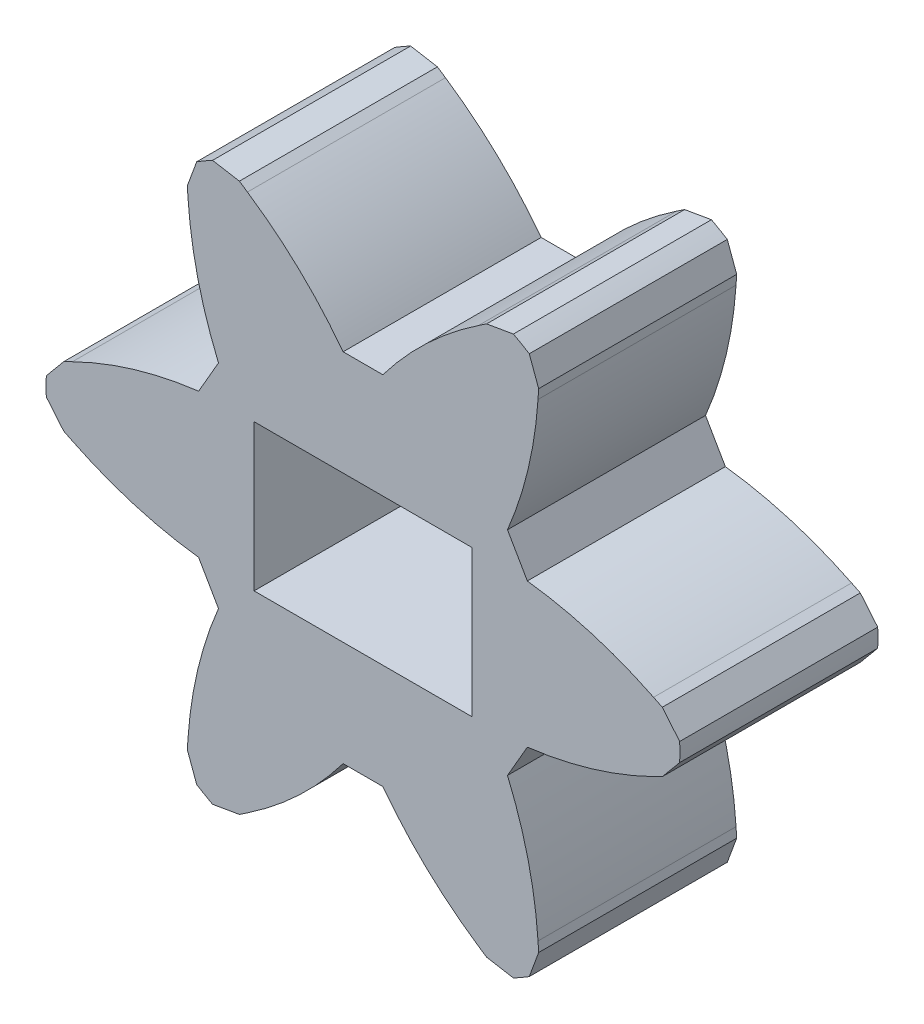
from build123d import *
from OCP.BRepFilletAPI import BRepFilletAPI_MakeChamfer

# Parameters (mm, degrees)
SKETCH1_R           = 8
SKETCH1_W           = 5.5
SKETCH1_H           = 3.7
BOSS_EXTRUDE1_DEPTH = 5
CUT_EXTRUDE1_DEPTH  = 13.369316877
CIRPATTERN1_COUNT   = 6
FILLET1_R           = 10
CHAMFER1_SIZE       = 1
CHAMFER1_SIZE2      = 0.5


with BuildPart() as part:
    # Sketch1 → Boss-Extrude1 (new body)
    with BuildSketch(Plane.XY):
        Circle(SKETCH1_R)
        Rectangle(SKETCH1_W, SKETCH1_H, mode=Mode.SUBTRACT)
    extrude(amount=BOSS_EXTRUDE1_DEPTH)

    # Sketch2 → Cut-Extrude1 (cut, through all)
    with BuildSketch(Plane.XY):
        Polygon((-7.331932906, 22.221764399), (0, 24.952212466), (7.331932906, 22.221764399), (3.798424573, 7.040736522), (3.120998591, 6.924019842), (1.330058439, 5.723612136), (0.501497444, 4.50257488), (-0.501497444, 4.50257488), (-1.330058439, 5.723612136), (-3.120998591, 6.924019842), (-3.798424573, 7.040736522), align=None)
    cut_extrude1 = extrude(amount=CUT_EXTRUDE1_DEPTH, mode=Mode.SUBTRACT)

    # CirPattern1: Cut-Extrude1 ×6 about axis
    cirpattern1_axis = Axis((0, 0, 0), (0, 0, 1))
    for i in range(1, CIRPATTERN1_COUNT):
        add(cut_extrude1.rotate(cirpattern1_axis, i * 360 / CIRPATTERN1_COUNT), mode=Mode.SUBTRACT)

    # Fillet1
    # the kernel refuses this fillet: 10 mm, written as the material it takes off along each edge
    with BuildSketch(Plane(origin=(-1.330058439, -5.723612136, -4.777865205), x_dir=(0.5615014183372642, 0.8274757743917586, 0), z_dir=(0, 0, 1)), Plane(origin=(5.621822731, 1.709941671, -4.777865205), x_dir=(-0.997365750808096, 0.07253660534518461, 0), z_dir=(0, 0, 1)), Plane(origin=(4.291764291, -4.013670465, -4.777865205), x_dir=(-0.43586433247083195, 0.9000123797369435, 0), z_dir=(0, 0, 1)), Plane(origin=(-5.621822731, -1.709941671, -4.777865205), x_dir=(0.997365750808096, -0.07253660534518423, 0), z_dir=(0, 0, 1)), Plane(origin=(-4.291764291, 4.013670465, -4.777865205), x_dir=(0.43586433247083256, -0.900012379736943, 0), z_dir=(0, 0, 1)), Plane(origin=(1.330058439, 5.723612136, -4.777865205), x_dir=(-0.561501418337264, -0.8274757743917588, 0), z_dir=(0, 0, 1))) as fillet1_piece_1:
        with BuildLine():
            CenterArc((1.975419419, 9.987502063), FILLET1_R, 247.992328485, 19.142820558)
            Line((-1.771887917, 0.716165173), (-1.846834064, 0.530738436))
            Line((-1.846834064, 0.530738436), (-0.074946147, -0.185426738))
            Line((-0.074946147, -0.185426738), (0, -0.2))
            ThreePointArc((0, -0.2), (0.737808461, -0.2), (1.465620873, -0.199750041))
            Line((1.465620873, -0.199750041), (1.475616922, 0))
        make_face()
    extrude(amount=14.55573041, mode=Mode.SUBTRACT)
    with BuildSketch(Plane(origin=(5.621822731, -1.709941671, -4.777865205), x_dir=(0.8975096924716217, 0.44099473003596645, 0), z_dir=(0, 0, 1)), Plane(origin=(1.330058439, -5.723612136, -4.777865205), x_dir=(0.8306674853820185, -0.5567688288052, 0), z_dir=(0, 0, 1)), Plane(origin=(-4.291764291, -4.013670465, -4.777865205), x_dir=(-0.06684220708960342, -0.9977635588411669, 0), z_dir=(0, 0, 1)), Plane(origin=(-5.621822731, 1.709941671, -4.777865205), x_dir=(-0.8975096924716216, -0.44099473003596684, 0), z_dir=(0, 0, 1)), Plane(origin=(4.291764291, 4.013670465, -4.777865205), x_dir=(0.06684220708960296, 0.9977635588411669, 0), z_dir=(0, 0, 1)), Plane(origin=(-1.330058439, 5.723612136, -4.777865205), x_dir=(-0.8306674853820185, 0.5567688288052001, 0), z_dir=(0, 0, 1))) as fillet1_piece_2:
        with BuildLine():
            CenterArc((1.911146082, 10), FILLET1_R, 250.857179442, 19.142820558)
            Line((-1.368094161, 0.552959012), (-1.433678966, 0.364018192))
            ThreePointArc((-1.433678966, 0.364018192), (-0.758993227, 0.091052768), (-0.074946147, -0.185426738))
            Line((-0.074946147, -0.185426738), (0, -0.2))
            Line((0, -0.2), (1.911146082, -0.2))
            Line((1.911146082, -0.2), (1.911146082, 0))
        make_face()
    extrude(amount=14.55573041, mode=Mode.SUBTRACT)

    # Chamfer1: one chamfer whose edges measure the first distance from different faces: ONE call of the kernel's chamfer builder (chamfer() names one face for all edges)
    chamfer1_edges_1 = [part.edges().sort_by_distance(p)[0] for p in [
        (-2.75, 0, 0),
    ]]
    chamfer1_side_1 = [part.faces().sort_by_distance(p)[0] for p in [
        (-2.75, 0, 2.5),
    ]]
    chamfer1_edges_2 = [part.edges().sort_by_distance(p)[0] for p in [
        (0, -1.85, 0),
    ]]
    chamfer1_side_2 = [part.faces().sort_by_distance(p)[0] for p in [
        (0, -1.85, 2.5),
    ]]
    chamfer1_edges_3 = [part.edges().sort_by_distance(p)[0] for p in [
        (2.75, 0, 0),
    ]]
    chamfer1_side_3 = [part.faces().sort_by_distance(p)[0] for p in [
        (2.75, 0, 2.5),
    ]]
    chamfer1_edges_4 = [part.edges().sort_by_distance(p)[0] for p in [
        (0, 1.85, 0),
    ]]
    chamfer1_side_4 = [part.faces().sort_by_distance(p)[0] for p in [
        (0, 1.85, 2.5),
    ]]
    chamfer1 = BRepFilletAPI_MakeChamfer(part.part.solid().wrapped)
    for e in chamfer1_edges_1:
        chamfer1.Add(CHAMFER1_SIZE, CHAMFER1_SIZE2, e.wrapped, chamfer1_side_1[0].wrapped)  # the first distance lies on this face
    for e in chamfer1_edges_2:
        chamfer1.Add(CHAMFER1_SIZE, CHAMFER1_SIZE2, e.wrapped, chamfer1_side_2[0].wrapped)  # the first distance lies on this face
    for e in chamfer1_edges_3:
        chamfer1.Add(CHAMFER1_SIZE, CHAMFER1_SIZE2, e.wrapped, chamfer1_side_3[0].wrapped)  # the first distance lies on this face
    for e in chamfer1_edges_4:
        chamfer1.Add(CHAMFER1_SIZE, CHAMFER1_SIZE2, e.wrapped, chamfer1_side_4[0].wrapped)  # the first distance lies on this face
    add(Compound.cast(chamfer1.Shape()), mode=Mode.REPLACE)


solid = part.part
